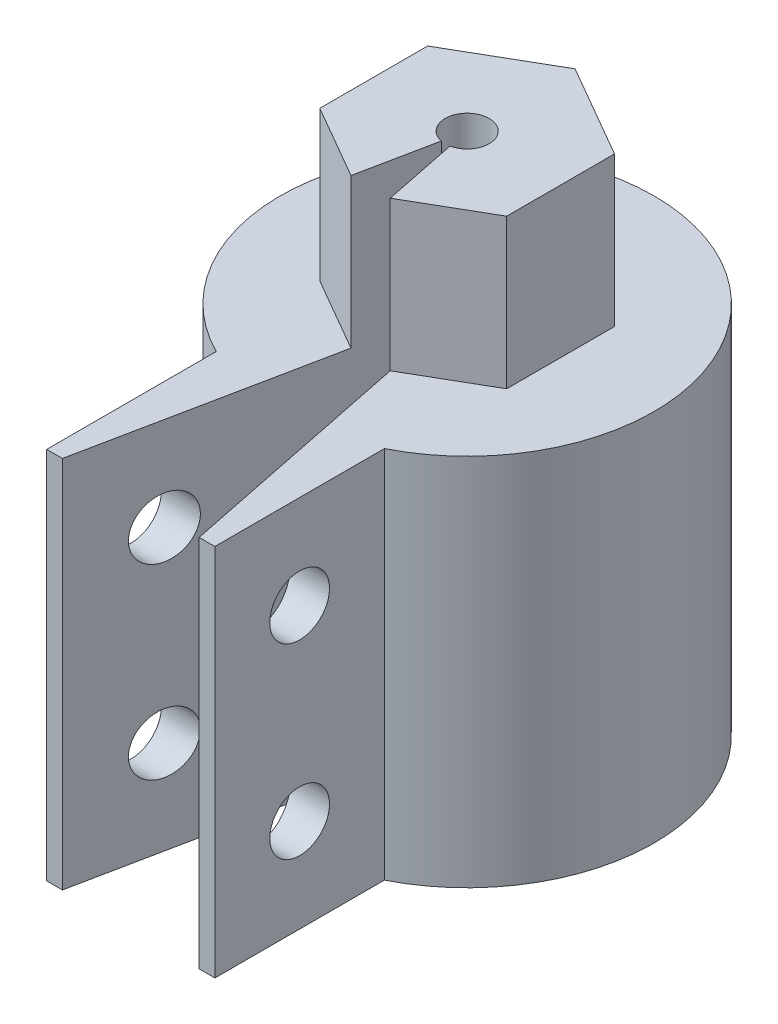
from build123d import *

# Parameters (mm, degrees)
EXTRUDE_1_DEPTH     = 20
EXTRUDE_2_DEPTH     = 8
CUT_EXTRUDE_1_DEPTH = 35.756294394
SKETCH_4_R          = 1.6
CUT_EXTRUDE_2_DEPTH = 37.307712679


with BuildPart() as part:
    # ｽｹｯﾁ1 → ﾎﾞｽ - 押し出し1 (new body)
    with BuildSketch(Plane(origin=(0, 0, 0), x_dir=(1, 0, 0), z_dir=(0, 1, 0))):
        with BuildLine():
            Line((-4.5, -8.93028555), (-4.5, -18))
            Line((-4.5, -18), (4.5, -18))
            Line((4.5, -18), (4.5, -8.93028555))
            ThreePointArc((4.5, -8.93028555), (0, 10), (-4.5, -8.93028555))
        make_face()
    extrude(amount=EXTRUDE_1_DEPTH)

    # ｽｹｯﾁ2 → ﾎﾞｽ - 押し出し2 (add)
    with BuildSketch(Plane(origin=(0, 20, 0), x_dir=(1, 0, 0), z_dir=(0, 1, 0))):
        Polygon((0, 5.773502692), (-5, 2.886751346), (-5, -2.886751346), (0, -5.773502692), (5, -2.886751346), (5, 2.886751346), align=None)
    extrude(amount=EXTRUDE_2_DEPTH)

    # ｽｹｯﾁ3 → ｶｯﾄ - 押し出し1 (cut, through all)
    with BuildSketch(Plane(origin=(0, 28, 0), x_dir=(1, 0, 0), z_dir=(0, 1, 0))):
        with BuildLine():
            Line((-3.658661061, -18), (-0.234043532, -1.151455003))
            ThreePointArc((-0.234043532, -1.151455003), (0, 1.175), (0.234043532, -1.151455003))
            Line((0.234043532, -1.151455003), (3.658661061, -18))
            ThreePointArc((3.658661061, -18), (0, -18.368064698), (-3.658661061, -18))
        make_face()
    extrude(amount=-CUT_EXTRUDE_1_DEPTH, mode=Mode.SUBTRACT)

    # ｽｹｯﾁ4 → ｶｯﾄ - 押し出し2 (cut, through all)
    with BuildSketch(Plane.ZY.offset(4.5)):
        with Locations((13.465142775, 15)):
            Circle(SKETCH_4_R)
        with Locations((13.465142775, 5)):
            Circle(SKETCH_4_R)
    extrude(amount=-CUT_EXTRUDE_2_DEPTH, mode=Mode.SUBTRACT)


solid = part.part
